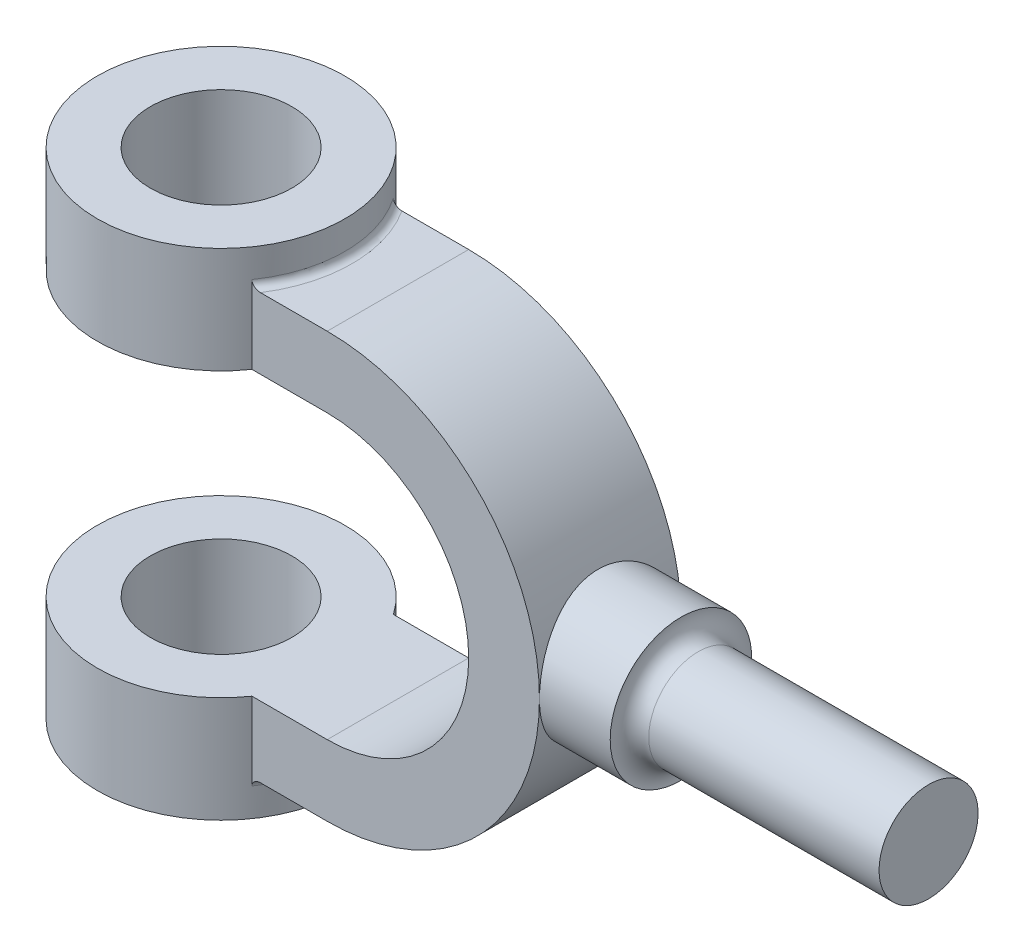
from build123d import *

# Parameters (mm, degrees)
BOSS_EXTRUDE1_DEPTH = 20
SKETCH2_R           = 35
SKETCH2_R_2         = 20
BOSS_EXTRUDE2_DEPTH = 30
FILLET1_R           = 2
FILLET2_R           = 2


with BuildPart() as part:
    # Sketch1 → Revolve-Thin1 (revolve)
    with BuildSketch(Plane.XY, mode=Mode.PRIVATE) as revolve_thin1_sk:
        with BuildLine():
            Line((56.568542495, 20), (80, 20))
            ThreePointArc((80, 20), (81.025996139, 15.83772234), (84.898979486, 14))
            Line((84.898979486, 14), (150, 14))
            Line((150, 14), (150, 0))
            Line((150, 0), (140, 0))
            Line((140, 0), (140, 4))
            Line((140, 4), (84.898979486, 4))
            ThreePointArc((84.898979486, 4), (78.190775553, 5.583592135), (72.898979486, 10))
            Line((72.898979486, 10), (56.568542495, 10))
            Line((56.568542495, 10), (56.568542495, 20))
        make_face()
    revolve(revolve_thin1_sk.sketch.rotate(Axis((-93.302775415, 0, 0), (1, 0, 0)), 90), axis=Axis((-93.302775415, 0, 0), (1, 0, 0)))

    # Sketch1<4> → Boss-Extrude1 (add, symmetric)
    with BuildSketch(Plane.XY):
        with BuildLine():
            Line((0, 60), (-21.3, 60))
            Line((-21.3, 60), (-21.3, 40))
            Line((-21.3, 40), (0, 40))
            ThreePointArc((0, 40), (40, 0), (0, -40))
            Line((0, -40), (-21.3, -40))
            Line((-21.3, -40), (-21.3, -60))
            Line((-21.3, -60), (0, -60))
            ThreePointArc((0, -60), (60, 0), (0, 60))
        make_face()
    extrude(amount=BOSS_EXTRUDE1_DEPTH, both=True)

    # Sketch2 → Boss-Extrude2 (add)
    with BuildSketch(Plane(origin=(0, 40, 0), x_dir=(1, 0, 0), z_dir=(0, 1, 0))):
        with Locations(Location((-50, 0, 0), (0, 0, 34.849904579))):
            Circle(SKETCH2_R)
        with Locations(Location((-50, 0, 0), (0, 0, 270))):
            Circle(SKETCH2_R_2, mode=Mode.SUBTRACT)
    boss_extrude2 = extrude(amount=BOSS_EXTRUDE2_DEPTH)

    # Fillet1
    # the kernel refuses this fillet: 2 mm, written as the material it adds along each edge
    with BuildSketch(Plane(origin=(-50, 60, 0), x_dir=(0.7309132797972386, 0, -0.682470349111259), z_dir=(-0.682470349111259, 0, -0.7309132797972386))) as fillet1_piece_1_section:
        with BuildLine():
            CenterArc((35 + FILLET1_R, -FILLET1_R), FILLET1_R, 90, 90)
            Line((35, -FILLET1_R), (35, 0))
            Line((35, 0), (35 + FILLET1_R, 0))
        make_face()
    fillet1_piece_1 = revolve(axis=Axis((-50, 60, 0), (0, -1, 0)), revolution_arc=86.073975491, mode=Mode.PRIVATE)
    fillet1_piece_1 = split(fillet1_piece_1, bisect_by=Plane(origin=(-14.43905365, 60.56094635, -20), z_dir=(0, 0, 1)), keep=Keep.TOP, mode=Mode.PRIVATE)
    fillet1_piece_1 = split(fillet1_piece_1, bisect_by=Plane(origin=(-14.43905365, 60.56094635, 20), z_dir=(0, 0, -1)), keep=Keep.TOP, mode=Mode.PRIVATE)
    add(fillet1_piece_1)

    # Mirror3: Boss-Extrude2 across plane
    add(boss_extrude2.mirror(Plane.ZX))

    # Fillet2
    # the kernel refuses this fillet: 2 mm, written as the material it adds along each edge
    with BuildSketch(Plane(origin=(-50, -60, 0), x_dir=(0.7309132797966846, 0, 0.6824703491118522), z_dir=(-0.6824703491118522, 0, 0.7309132797966846))) as fillet2_piece_1_section:
        with BuildLine():
            CenterArc((35 + FILLET2_R, -FILLET2_R), FILLET2_R, 90, 90)
            Line((35, -FILLET2_R), (35, 0))
            Line((35, 0), (35 + FILLET2_R, 0))
        make_face()
    fillet2_piece_1 = revolve(axis=Axis((-50, -60, 0), (0, 1, 0)), revolution_arc=86.073975491, mode=Mode.PRIVATE)
    fillet2_piece_1 = split(fillet2_piece_1, bisect_by=Plane(origin=(-14.439053646, -60.560946354, -20), z_dir=(0, 0, 1)), keep=Keep.TOP, mode=Mode.PRIVATE)
    fillet2_piece_1 = split(fillet2_piece_1, bisect_by=Plane(origin=(-14.439053646, -60.560946354, 20), z_dir=(0, 0, -1)), keep=Keep.TOP, mode=Mode.PRIVATE)
    add(fillet2_piece_1)


solid = part.part
